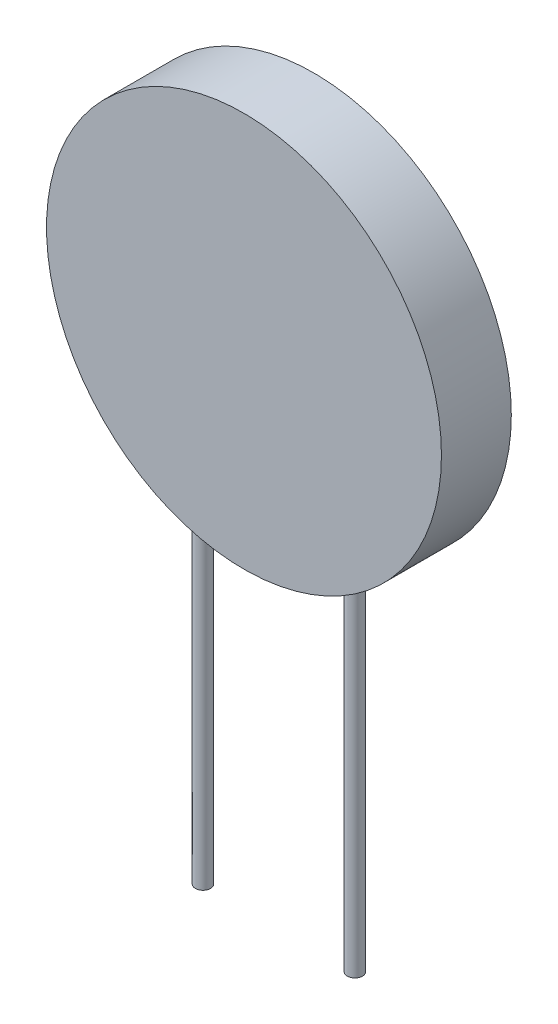
from build123d import *

# Parameters (mm, degrees)
SKETCH1_R           = 13
BOSS_EXTRUDE1_DEPTH = 2.3
SKETCH2_R           = 0.5
BOSS_EXTRUDE2_DEPTH = 34.6


with BuildPart() as part:
    # Sketch1 → Boss-Extrude1 (new, symmetric)
    with BuildSketch(Plane.XY):
        Circle(SKETCH1_R)
    extrude(amount=BOSS_EXTRUDE1_DEPTH, both=True)

    # Sketch2 → Boss-Extrude2 (add)
    with BuildSketch(Plane(origin=(0, 0, 0), x_dir=(1, 0, 0), z_dir=(0, 1, 0))):
        with Locations((-5, 0)):
            Circle(SKETCH2_R)
        with Locations((5, 0)):
            Circle(SKETCH2_R)
    extrude(amount=-BOSS_EXTRUDE2_DEPTH)


solid = part.part
